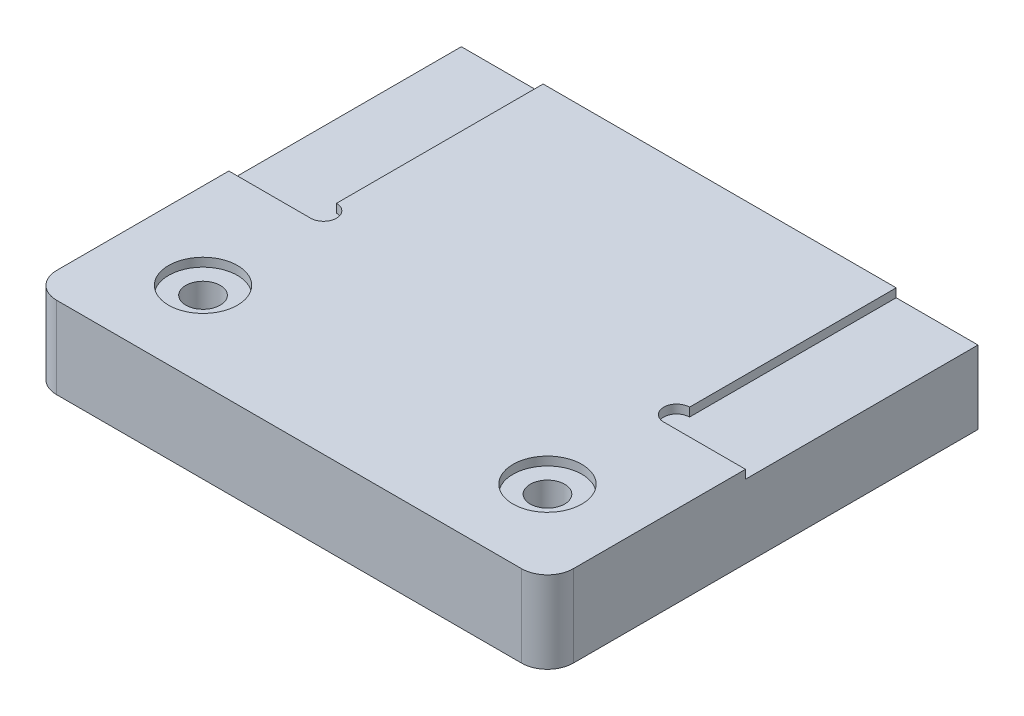
from build123d import *

# Parameters (mm, degrees)
SKETCH_1_W          = 60
SKETCH_1_H          = 50
EXTRUDE_1_DEPTH     = 9.5
FILLET_1_R          = 3
SKETCH_2_R          = 4
CUT_EXTRUDE_1_DEPTH = 1
CUT_EXTRUDE_2_DEPTH = 1
SKETCH_5_R          = 2
CUT_EXTRUDE_3_DEPTH = 41.190172928


with BuildPart() as part:
    # 草图1 → 凸台-拉伸1 (new body)
    with BuildSketch(Plane(origin=(0, 0, 0), x_dir=(1, 0, 0), z_dir=(0, 1, 0))):
        Rectangle(SKETCH_1_W, SKETCH_1_H)
    extrude(amount=EXTRUDE_1_DEPTH)

    # 圆角1
    fillet_1_edges = [part.edges().sort_by_distance(p)[0] for p in [
        (-30, 4.75, 25),
        (30, 4.75, 25),
    ]]
    fillet(fillet_1_edges, radius=FILLET_1_R)

    # 草图2 → 切除-拉伸1 (cut)
    with BuildSketch(Plane(origin=(0, 9.5, 0), x_dir=(1, 0, 0), z_dir=(0, 1, 0))):
        with Locations((-20, -15)):
            Circle(SKETCH_2_R)
        with Locations((20, -15)):
            Circle(SKETCH_2_R)
    extrude(amount=-CUT_EXTRUDE_1_DEPTH, mode=Mode.SUBTRACT)

    # 草图4 → 切除-拉伸2 (cut)
    with BuildSketch(Plane(origin=(0, 9.5, 0), x_dir=(1, 0, 0), z_dir=(0, 1, 0))):
        with BuildLine():
            Line((-30, 25), (-20.5, 25))
            Line((-20.5, 25), (-20.5, 1))
            ThreePointArc((-20.5, 1), (-19, -0.5), (-20.5, -2))
            Line((-20.5, -2), (-30, -2))
            Line((-30, -2), (-30, 25))
        make_face()
        with BuildLine():
            Line((20.5, -2), (30, -2))
            Line((30, -2), (30, 25))
            Line((30, 25), (20.5, 25))
            Line((20.5, 25), (20.5, 1))
            ThreePointArc((20.5, 1), (19, -0.5), (20.5, -2))
        make_face()
    extrude(amount=-CUT_EXTRUDE_2_DEPTH, mode=Mode.SUBTRACT)

    # 草图5 → 切除-拉伸3 (cut, through all)
    with BuildSketch(Plane(origin=(0, 9.5, 0), x_dir=(1, 0, 0), z_dir=(0, 1, 0))):
        with Locations((-20, -15)):
            Circle(SKETCH_5_R)
        with Locations((20, -15)):
            Circle(SKETCH_5_R)
    extrude(amount=-CUT_EXTRUDE_3_DEPTH, mode=Mode.SUBTRACT)


solid = part.part
